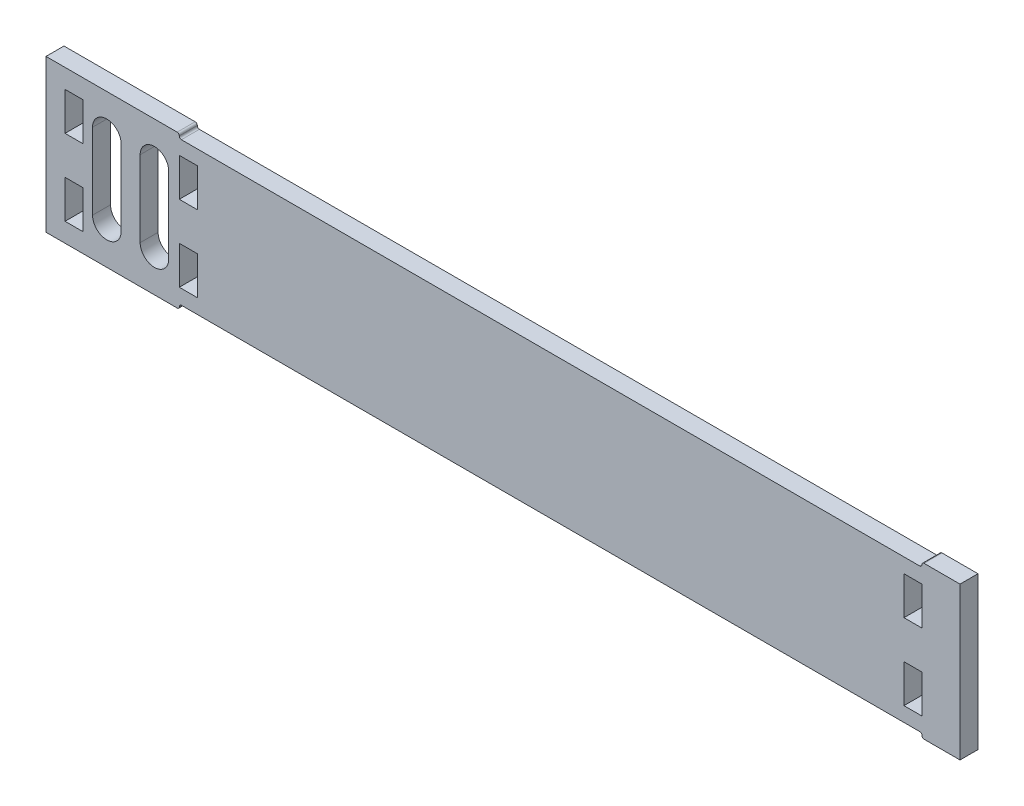
from build123d import *

# Parameters (mm, degrees)
SKETCH1_W           = 304.8
SKETCH1_H           = 50.8
SKETCH1_W_2         = 5.9944
SKETCH1_H_2         = 12.7
BOSS_EXTRUDE1_DEPTH = 5.9944
CUT_EXTRUDE2_DEPTH  = 5.9944
SKETCH3_W           = 247.65
SKETCH3_H           = 1.4875
CUT_EXTRUDE3_DEPTH  = 310.062473994
FILLET4_R           = 0.7


with BuildPart() as part:
    # Sketch1 → Boss-Extrude1 (new body)
    with BuildSketch(Plane.XY):
        with Locations((-152.4, 25.4)):
            Rectangle(SKETCH1_W, SKETCH1_H)
        with Locations((-15.6972, 12.7)):
            Rectangle(SKETCH1_W_2, SKETCH1_H_2, mode=Mode.SUBTRACT)
        with Locations((-15.6972, 38.1)):
            Rectangle(SKETCH1_W_2, SKETCH1_H_2, mode=Mode.SUBTRACT)
        with Locations((-257.3528, 38.1)):
            Rectangle(SKETCH1_W_2, SKETCH1_H_2, mode=Mode.SUBTRACT)
        with Locations((-257.3528, 12.7)):
            Rectangle(SKETCH1_W_2, SKETCH1_H_2, mode=Mode.SUBTRACT)
        with Locations((-295.4528, 12.7)):
            Rectangle(SKETCH1_W_2, SKETCH1_H_2, mode=Mode.SUBTRACT)
        with Locations((-295.4528, 38.1)):
            Rectangle(SKETCH1_W_2, SKETCH1_H_2, mode=Mode.SUBTRACT)
    extrude(amount=BOSS_EXTRUDE1_DEPTH)

    # Sketch2 → Cut-Extrude2 (cut)
    with BuildSketch(Plane.XY.offset(5.9944)):
        with BuildLine():
            Line((-289.2806, 12.7), (-289.2806, 38.1))
            ThreePointArc((-289.2806, 38.1), (-284.5181, 42.8625), (-279.7556, 38.1))
            Line((-279.7556, 38.1), (-279.7556, 12.7))
            ThreePointArc((-279.7556, 12.7), (-284.5181, 7.9375), (-289.2806, 12.7))
        make_face()
        with BuildLine():
            Line((-273.4056, 12.7), (-273.4056, 38.1))
            ThreePointArc((-273.4056, 38.1), (-268.6431, 42.8625), (-263.8806, 38.1))
            Line((-263.8806, 38.1), (-263.8806, 12.7))
            ThreePointArc((-263.8806, 12.7), (-268.6431, 7.9375), (-273.4056, 12.7))
        make_face()
    extrude(amount=-CUT_EXTRUDE2_DEPTH, mode=Mode.SUBTRACT)

    # Sketch3 → Cut-Extrude3 (cut, through all)
    with BuildSketch(Plane.XY.offset(5.9944)):
        with Locations((-136.525, 50.05625)):
            Rectangle(SKETCH3_W, SKETCH3_H)
        with Locations((-136.525, 0.74375)):
            Rectangle(SKETCH3_W, SKETCH3_H)
    extrude(amount=-CUT_EXTRUDE3_DEPTH, mode=Mode.SUBTRACT)

    # Fillet4
    fillet4_edges = [part.edges().sort_by_distance(p)[0] for p in [
        (-12.7, 50.8, 2.9972),
        (-12.7, 49.3125, 2.9972),
        (-260.35, 50.8, 2.9972),
        (-260.35, 49.3125, 2.9972),
        (-260.35, 0, 2.9972),
        (-260.35, 1.4875, 2.9972),
        (-12.7, 0, 2.9972),
        (-12.7, 1.4875, 2.9972),
    ]]
    fillet(fillet4_edges, radius=FILLET4_R)


solid = part.part
